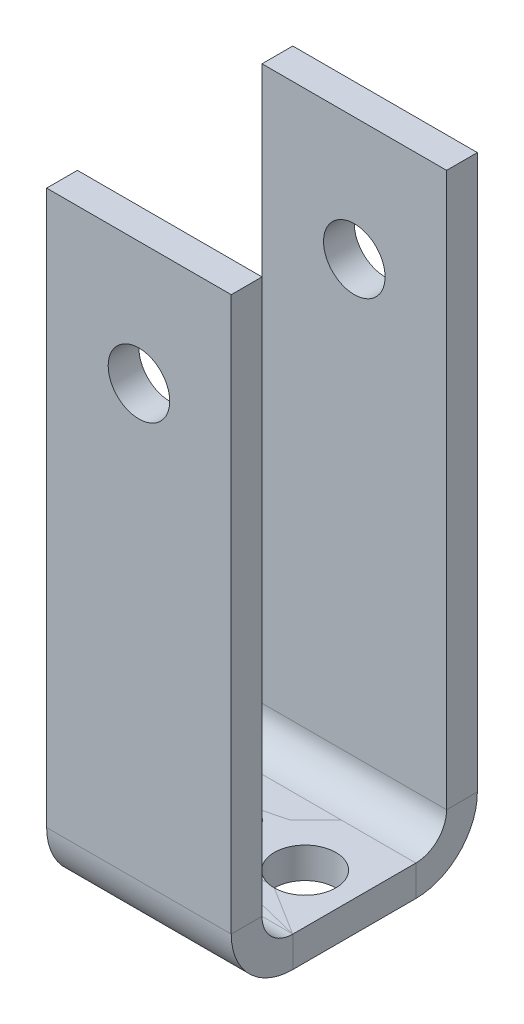
from build123d import *

# Parameters (mm, degrees)
SKETCH1_W                            = 19.05
SKETCH1_H                            = 12.7
BOSS_EXTRUDE1_DEPTH                  = 3.175
CONVERT_SOLID3_OUTLINE_W             = 3.175
CONVERT_SOLID3_OUTLINE_H             = 12.7
CONVERT_SOLID3_DEPTH                 = 19.05
EDGE_FLANGE1_DEPTH                   = 19.05
EDGE_FLANGE1_BEND_DEPTH              = 19.05
EDGE_FLANGE3_DEPTH                   = 12.7
CUT_EXTRUDE1_DEPTH                   = 71.995158286
CUT_EXTRUDE1_DEPTH_BACK              = 71.995158286
SKETCH23_R                           = 3.175
F_1_4_0_25_DIAMETER_HOLE1_AT_2_COUNT = 2
F_1_4_0_25_DIAMETER_HOLE1_AT_2_PITCH = 8.89
F_1_4_0_25_DIAMETER_HOLE2_AT_2_COUNT = 2
F_1_4_0_25_DIAMETER_HOLE2_AT_2_PITCH = 8.89


# Read off the part's stored shape, not the designer's step: Convert-Solid3
# Sheet-metal steps are written as plain solids
with BuildPart() as part:
    # Sketch1 → Boss-Extrude1 (new body)
    with BuildSketch(Plane(origin=(0, 0, 0), x_dir=(1, 0, 0), z_dir=(0, 1, 0))):
        with Locations((9.525, 6.35)):
            Rectangle(SKETCH1_W, SKETCH1_H)
    extrude(amount=BOSS_EXTRUDE1_DEPTH)


with BuildPart() as body_2:
    # Convert-Solid3 outline → Convert-Solid3 (new body)
    with BuildSketch(Plane.YZ):
        with Locations((1.5875, -6.35)):
            Rectangle(CONVERT_SOLID3_OUTLINE_W, CONVERT_SOLID3_OUTLINE_H)
    extrude(amount=CONVERT_SOLID3_DEPTH)

    # Edge-Flange1 section (across the edge) → Edge-Flange1 (add)
    with BuildSketch(Plane(origin=(19.05, 3.175, -15.875), x_dir=(0, 0, 1), z_dir=(-1, 0, 0))):
        with BuildLine():
            Line((-3.175, 3.175), (-3.175, 60.325))
            Line((-3.175, 60.325), (0, 60.325))
            Line((0, 60.325), (0, 3.175))
            ThreePointArc((0, 3.175), (0.92993597, 0.92993597), (3.175, 0))
            Line((3.175, 0), (3.175, -3.175))
            ThreePointArc((3.175, -3.175), (-1.315128061, -1.315128061), (-3.175, 3.175))
        make_face()
    extrude(amount=EDGE_FLANGE1_DEPTH)

    # Edge-Flange1 section 2 (across the edge) → Edge-Flange1 bend (add)
    with BuildSketch(Plane(origin=(0, 3.175, 3.175), x_dir=(0, 0, -1), z_dir=(1, 0, 0))):
        with BuildLine():
            Line((-3.175, 3.175), (-3.175, 60.325))
            Line((-3.175, 60.325), (0, 60.325))
            Line((0, 60.325), (0, 3.175))
            ThreePointArc((0, 3.175), (0.92993597, 0.92993597), (3.175, 0))
            Line((3.175, 0), (3.175, -3.175))
            ThreePointArc((3.175, -3.175), (-1.315128061, -1.315128061), (-3.175, 3.175))
        make_face()
    extrude(amount=EDGE_FLANGE1_BEND_DEPTH)

    # Edge-Flange3 section (across the edge) → Edge-Flange3 (add)
    with BuildSketch(Plane(origin=(-3.175, 3.175, -12.7), x_dir=(1, 0, 0), z_dir=(0, 0, 1))):
        with BuildLine():
            Line((-3.175, 3.175), (-3.175, 28.575))
            Line((-3.175, 28.575), (0, 28.575))
            Line((0, 28.575), (0, 3.175))
            ThreePointArc((0, 3.175), (0.92993597, 0.92993597), (3.175, 0))
            Line((3.175, 0), (3.175, -3.175))
            ThreePointArc((3.175, -3.175), (-1.315128061, -1.315128061), (-3.175, 3.175))
        make_face()
    extrude(amount=EDGE_FLANGE3_DEPTH)

    # Sketch23 → Cut-Extrude1 (cut, two sides: drawn at the far end of the back side and taken through both)
    with BuildSketch(Plane.XY.offset(6.35).offset(-CUT_EXTRUDE1_DEPTH_BACK)):
        with Locations(Location((9.525, 50.8, 0), (0, 0, 180))):
            Circle(SKETCH23_R)
    extrude(amount=CUT_EXTRUDE1_DEPTH + CUT_EXTRUDE1_DEPTH_BACK, mode=Mode.SUBTRACT)


with BuildPart() as f_1_4_0_25_diameter_hole1_tool:
    # Sketch25 → 1/4 (0.25) Diameter Hole1 (revolve)
    with BuildSketch(Plane(origin=(5.08, 3.175, -6.35), x_dir=(0, 0, 1), z_dir=(1, 0, 0))):
        Polygon((0, 0), (0, 18.417732465), (3.175, 16.51), (3.175, 0), align=None)
    f_1_4_0_25_diameter_hole1 = revolve(axis=Axis((5.08, 9.525, -6.35), (0, -1, 0)))


with BuildPart() as part_1:
    add(part.part)

    # 1/4 (0.25) Diameter Hole1: cut by f_1_4_0_25_diameter_hole1_tool
    add(f_1_4_0_25_diameter_hole1_tool.part, mode=Mode.SUBTRACT)


with BuildPart() as body_2_1:
    add(body_2.part)

    # 1/4 (0.25) Diameter Hole1: cut by f_1_4_0_25_diameter_hole1_tool
    add(f_1_4_0_25_diameter_hole1_tool.part, mode=Mode.SUBTRACT)


with BuildPart() as f_1_4_0_25_diameter_hole1_at_2_tool:
    # 1/4 (0.25) Diameter Hole1 at 2: 1/4 (0.25) Diameter Hole1 ×2
    with Locations(*[(i * F_1_4_0_25_DIAMETER_HOLE1_AT_2_PITCH, 0, 0) for i in range(1, F_1_4_0_25_DIAMETER_HOLE1_AT_2_COUNT)]):
        add(f_1_4_0_25_diameter_hole1)


with BuildPart() as part_2:
    add(part_1.part)

    # 1/4 (0.25) Diameter Hole1 at 2: cut by f_1_4_0_25_diameter_hole1_at_2_tool
    add(f_1_4_0_25_diameter_hole1_at_2_tool.part, mode=Mode.SUBTRACT)


with BuildPart() as body_2_2:
    add(body_2_1.part)

    # 1/4 (0.25) Diameter Hole1 at 2: cut by f_1_4_0_25_diameter_hole1_at_2_tool
    add(f_1_4_0_25_diameter_hole1_at_2_tool.part, mode=Mode.SUBTRACT)

    # Sketch38 → 1/4 (0.25) Diameter Hole2 (revolve, cut)
    with BuildSketch(Plane(origin=(-3.175, 10.16, -6.35), x_dir=(0, 0, -1), z_dir=(0, 1, 0))):
        Polygon((0, 0), (0, 18.417732465), (3.175, 16.51), (3.175, 0), align=None)
    f_1_4_0_25_diameter_hole2 = revolve(axis=Axis((3.175, 10.16, -6.35), (-1, 0, 0)), mode=Mode.SUBTRACT)

    # 1/4 (0.25) Diameter Hole2 at 2: 1/4 (0.25) Diameter Hole2 ×2
    with Locations(*[(0, i * F_1_4_0_25_DIAMETER_HOLE2_AT_2_PITCH, 0) for i in range(1, F_1_4_0_25_DIAMETER_HOLE2_AT_2_COUNT)]):
        add(f_1_4_0_25_diameter_hole2, mode=Mode.SUBTRACT)


solid = Compound([part_2.part, body_2_2.part])
